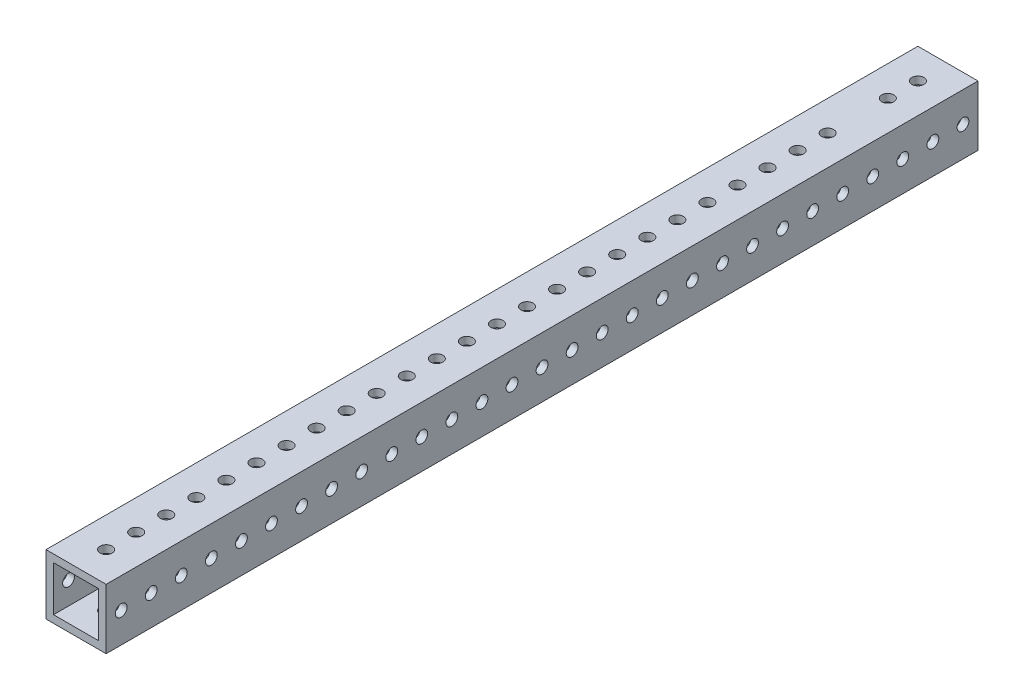
from build123d import *

# Parameters (mm, degrees)
SKETCH1_W           = 25.4
SKETCH1_H           = 25.4
SKETCH1_W_2         = 19.05
SKETCH1_H_2         = 19.05
BOSS_EXTRUDE1_DEPTH = 184.15
SKETCH2_R           = 2.5527
CUT_EXTRUDE1_DEPTH  = 187.326789539
SKETCH4_R           = 2.4892
CUT_EXTRUDE3_DEPTH  = 187.326789539


with BuildPart() as part:
    # Sketch1 → Boss-Extrude1 (new, symmetric)
    with BuildSketch(Plane.XY):
        Rectangle(SKETCH1_W, SKETCH1_H)
        Rectangle(SKETCH1_W_2, SKETCH1_H_2, mode=Mode.SUBTRACT)
    extrude(amount=BOSS_EXTRUDE1_DEPTH, both=True)

    # Sketch2 → Cut-Extrude1 (cut, through all)
    with BuildSketch(Plane(origin=(0, 12.7, 0), x_dir=(1, 0, 0), z_dir=(0, 1, 0))):
        with Locations((0, -171.45)):
            Circle(SKETCH2_R)
        with Locations((0, -158.75)):
            Circle(SKETCH2_R)
        with Locations((0, -146.05)):
            Circle(SKETCH2_R)
        with Locations((0, -133.35)):
            Circle(SKETCH2_R)
        with Locations((0, -120.65)):
            Circle(SKETCH2_R)
        with Locations((0, -107.95)):
            Circle(SKETCH2_R)
        with Locations((0, -95.25)):
            Circle(SKETCH2_R)
        with Locations((0, -82.55)):
            Circle(SKETCH2_R)
        with Locations((0, -69.85)):
            Circle(SKETCH2_R)
        with Locations((0, -57.15)):
            Circle(SKETCH2_R)
        with Locations((0, -44.45)):
            Circle(SKETCH2_R)
        with Locations((0, -31.75)):
            Circle(SKETCH2_R)
        with Locations((0, -19.05)):
            Circle(SKETCH2_R)
        with Locations((0, -6.35)):
            Circle(SKETCH2_R)
        with Locations((0, 6.35)):
            Circle(SKETCH2_R)
        with Locations((0, 19.05)):
            Circle(SKETCH2_R)
        with Locations((0, 31.75)):
            Circle(SKETCH2_R)
        with Locations((0, 44.45)):
            Circle(SKETCH2_R)
        with Locations((0, 57.15)):
            Circle(SKETCH2_R)
        with Locations((0, 69.85)):
            Circle(SKETCH2_R)
        with Locations((0, 82.55)):
            Circle(SKETCH2_R)
        with Locations((0, 95.25)):
            Circle(SKETCH2_R)
        with Locations((0, 107.95)):
            Circle(SKETCH2_R)
        with Locations((0, 120.65)):
            Circle(SKETCH2_R)
        with Locations((0, 133.35)):
            Circle(SKETCH2_R)
        with Locations((25.4, 146.05)):
            Circle(SKETCH2_R)
        with Locations((0, 158.75)):
            Circle(SKETCH2_R)
        with Locations((0, 171.45)):
            Circle(SKETCH2_R)
        with Locations((0, 196.85)):
            Circle(SKETCH2_R)
        with Locations((0, 209.55)):
            Circle(SKETCH2_R)
        with Locations((0, 222.25)):
            Circle(SKETCH2_R)
        with Locations((0, 234.95)):
            Circle(SKETCH2_R)
        with Locations((0, 247.65)):
            Circle(SKETCH2_R)
        with Locations((0, 260.35)):
            Circle(SKETCH2_R)
        with Locations((0, 273.05)):
            Circle(SKETCH2_R)
        with Locations((0, 285.75)):
            Circle(SKETCH2_R)
        with Locations((0, 298.45)):
            Circle(SKETCH2_R)
        with Locations((0, 311.15)):
            Circle(SKETCH2_R)
        with Locations((0, 323.85)):
            Circle(SKETCH2_R)
        with Locations((0, 336.55)):
            Circle(SKETCH2_R)
        with Locations((0, 349.25)):
            Circle(SKETCH2_R)
        with Locations((0, 361.95)):
            Circle(SKETCH2_R)
        with Locations((0, 374.65)):
            Circle(SKETCH2_R)
        with Locations((0, 387.35)):
            Circle(SKETCH2_R)
        with Locations((0, 400.05)):
            Circle(SKETCH2_R)
        with Locations((0, 412.75)):
            Circle(SKETCH2_R)
    extrude(amount=-CUT_EXTRUDE1_DEPTH, mode=Mode.SUBTRACT)

    # Sketch4 → Cut-Extrude3 (cut, through all)
    with BuildSketch(Plane(origin=(12.7, 0, 0), x_dir=(0, 0, -1), z_dir=(1, 0, 0))):
        with Locations((-177.8, 0)):
            Circle(SKETCH4_R)
        with Locations((-165.1, 0)):
            Circle(SKETCH4_R)
        with Locations((-152.4, 0)):
            Circle(SKETCH4_R)
        with Locations((-139.7, 0)):
            Circle(SKETCH4_R)
        with Locations((-127, 0)):
            Circle(SKETCH4_R)
        with Locations((254, 0)):
            Circle(SKETCH4_R)
        with Locations((266.7, 0)):
            Circle(SKETCH4_R)
        with Locations((279.4, 0)):
            Circle(SKETCH4_R)
        with Locations((292.1, 0)):
            Circle(SKETCH4_R)
        with Locations((304.8, 0)):
            Circle(SKETCH4_R)
        with Locations((317.5, 0)):
            Circle(SKETCH4_R)
        with Locations((330.2, 0)):
            Circle(SKETCH4_R)
        with Locations((342.9, 0)):
            Circle(SKETCH4_R)
        with Locations((355.6, 0)):
            Circle(SKETCH4_R)
        with Locations((368.3, 0)):
            Circle(SKETCH4_R)
        with Locations((381, 0)):
            Circle(SKETCH4_R)
        with Locations((393.7, 0)):
            Circle(SKETCH4_R)
        with Locations((406.4, 0)):
            Circle(SKETCH4_R)
        with Locations((419.1, 0)):
            Circle(SKETCH4_R)
        with Locations((-114.3, 0)):
            Circle(SKETCH4_R)
        with Locations((-101.6, 0)):
            Circle(SKETCH4_R)
        with Locations((-88.9, 0)):
            Circle(SKETCH4_R)
        with Locations((-76.2, 0)):
            Circle(SKETCH4_R)
        with Locations((-63.5, 0)):
            Circle(SKETCH4_R)
        with Locations((-50.8, 0)):
            Circle(SKETCH4_R)
        with Locations((-38.1, 0)):
            Circle(SKETCH4_R)
        with Locations((-25.4, 0)):
            Circle(SKETCH4_R)
        with Locations((-12.7, 0)):
            Circle(SKETCH4_R)
        Circle(SKETCH4_R)
        with Locations((12.7, 0)):
            Circle(SKETCH4_R)
        with Locations((25.4, 0)):
            Circle(SKETCH4_R)
        with Locations((38.1, 0)):
            Circle(SKETCH4_R)
        with Locations((50.8, 0)):
            Circle(SKETCH4_R)
        with Locations((63.5, 0)):
            Circle(SKETCH4_R)
        with Locations((76.2, 0)):
            Circle(SKETCH4_R)
        with Locations((88.9, 0)):
            Circle(SKETCH4_R)
        with Locations((101.6, 0)):
            Circle(SKETCH4_R)
        with Locations((114.3, 0)):
            Circle(SKETCH4_R)
        with Locations((127, 0)):
            Circle(SKETCH4_R)
        with Locations((139.7, 0)):
            Circle(SKETCH4_R)
        with Locations((152.4, 0)):
            Circle(SKETCH4_R)
        with Locations((165.1, 0)):
            Circle(SKETCH4_R)
        with Locations((177.8, 0)):
            Circle(SKETCH4_R)
        with Locations((190.5, 0)):
            Circle(SKETCH4_R)
        with Locations((203.2, 0)):
            Circle(SKETCH4_R)
        with Locations((215.9, 0)):
            Circle(SKETCH4_R)
        with Locations((228.6, 0)):
            Circle(SKETCH4_R)
        with Locations((241.3, 0)):
            Circle(SKETCH4_R)
    extrude(amount=-CUT_EXTRUDE3_DEPTH, mode=Mode.SUBTRACT)


solid = part.part
